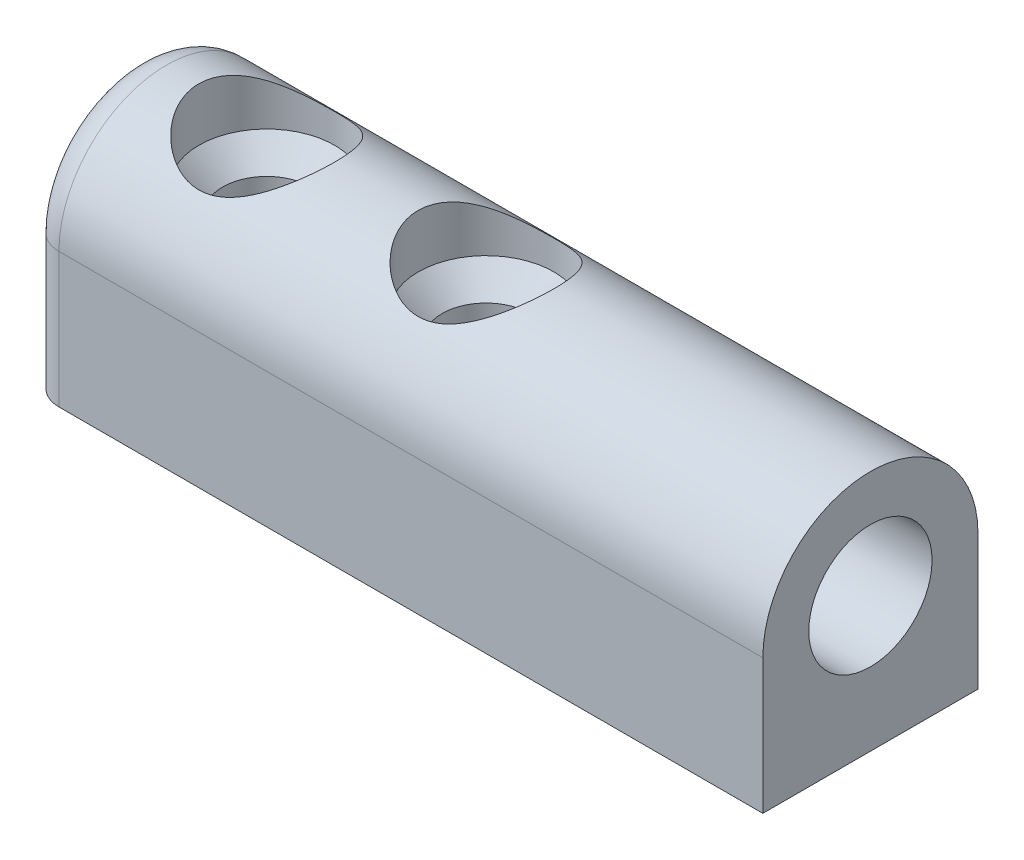
from build123d import *

# Parameters (mm, degrees)
ESBO_O1_R                = 2.95
RESSALTO_EXTRUS_O1_DEPTH = 17.6
RESSALTO_EXTRUS_O2_START = -20.5
RESSALTO_EXTRUS_O2_DEPTH = 20.5
FILETE1_R                = 1.5
ESBO_O3_R                = 3.25
CORTE_EXTRUS_O1_DEPTH    = 22.699009104
ESBO_O5_R                = 3.25
ESBO_O5_R_2              = 2.1
RESSALTO_EXTRUS_O3_DEPTH = 9.1
CHANFRO1_SIZE            = 1.2


with BuildPart() as part:
    # Esboço1 → Ressalto-extrusão1 (new, symmetric)
    with BuildSketch(Plane(origin=(0, 0, 0), x_dir=(0, 0, -1), z_dir=(1, 0, 0))):
        with BuildLine():
            Line((5.15, -6.450193796), (-5.15, -6.450193796))
            Line((-5.15, -6.450193796), (-5.15, 0))
            ThreePointArc((-5.15, 0), (0, 5.15), (5.15, 0))
            Line((5.15, 0), (5.15, -6.450193796))
        make_face()
        Circle(ESBO_O1_R, mode=Mode.SUBTRACT)
    extrude(amount=RESSALTO_EXTRUS_O1_DEPTH, both=True)

    # Esboço2 → Ressalto-extrusão2 (add)
    with BuildSketch(Plane.ZY.offset(17.6).offset(RESSALTO_EXTRUS_O2_START)):
        with BuildLine():
            Line((-5.15, 0), (-5.15, -6.450193796))
            Line((-5.15, -6.450193796), (5.15, -6.450193796))
            Line((5.15, -6.450193796), (5.15, 0))
            ThreePointArc((5.15, 0), (0, 5.15), (-5.15, 0))
        make_face()
    extrude(amount=RESSALTO_EXTRUS_O2_DEPTH)

    # Filete1
    filete1_edges = [part.edges().sort_by_distance(p)[0] for p in [
        (-17.6, -3.225096898, -5.15),
        (-17.6, -3.225096898, 5.15),
        (-17.6, 5.15, 0),
    ]]
    fillet(filete1_edges, radius=FILETE1_R)

    # Esboço3 → Corte-extrusão1 (cut, through all)
    with BuildSketch(Plane.XZ.offset(6.450193796)):
        with Locations(Location((-11.3, 0, 0), (0, 0, 270))):
            Circle(ESBO_O3_R)
        with Locations(Location((-0.8, 0, 0), (0, 0, 270))):
            Circle(ESBO_O3_R)
    extrude(amount=-CORTE_EXTRUS_O1_DEPTH, mode=Mode.SUBTRACT)

    # Esboço5 → Ressalto-extrusão3 (add)
    # profile 1 of 2: a face of its own
    with BuildSketch(Plane.XZ.offset(6.450193796)):
        with Locations(Location((-0.8, 0, 0), (0, 0, 270))):
            Circle(ESBO_O5_R)
        with Locations(Location((-0.8, 0, 0), (0, 0, 270))):
            Circle(ESBO_O5_R_2, mode=Mode.SUBTRACT)
    # profile 2 of 2: a face of its own
    with BuildSketch(Plane.XZ.offset(6.450193796)):
        with Locations(Location((-11.3, 0, 0), (0, 0, 270))):
            Circle(ESBO_O5_R)
        with Locations(Location((-11.3, 0, 0), (0, 0, 270))):
            Circle(ESBO_O5_R_2, mode=Mode.SUBTRACT)
    extrude(amount=-RESSALTO_EXTRUS_O3_DEPTH)

    # Chanfro1
    # the kernel refuses this chamfer: 1.2 mm, written as the material it takes off along each edge
    with BuildSketch(Plane(origin=(-11.3, 2.649806204, 0), x_dir=(0, 0, -1), z_dir=(-1, 0, 0))) as chanfro1_piece_1_section:
        Polygon((2.1 + CHANFRO1_SIZE, 0), (2.1, CHANFRO1_SIZE), (2.1, 0), align=None)
    chanfro1_piece_1 = revolve(axis=Axis((-11.3, 2.649806204, 0), (0, -1, 0)), mode=Mode.PRIVATE)
    chanfro1_piece_1 = chanfro1_piece_1 & Plane(origin=(-11.3, 2.024165302, 0), x_dir=(0, 0, -1), z_dir=(0, -1, 0)) * Cylinder(3.25, 14, mode=Mode.PRIVATE)
    add(chanfro1_piece_1, mode=Mode.SUBTRACT)
    with BuildSketch(Plane(origin=(-0.8, 2.649806204, 0), x_dir=(0, 0, -1), z_dir=(-1, 0, 0))) as chanfro1_piece_2_section:
        Polygon((2.1 + CHANFRO1_SIZE, 0), (2.1, CHANFRO1_SIZE), (2.1, 0), align=None)
    chanfro1_piece_2 = revolve(axis=Axis((-0.8, 2.649806204, 0), (0, -1, 0)), mode=Mode.PRIVATE)
    chanfro1_piece_2 = chanfro1_piece_2 & Plane(origin=(-0.8, 2.024165302, 0), x_dir=(0, 0, -1), z_dir=(0, -1, 0)) * Cylinder(3.25, 14, mode=Mode.PRIVATE)
    add(chanfro1_piece_2, mode=Mode.SUBTRACT)


solid = part.part
